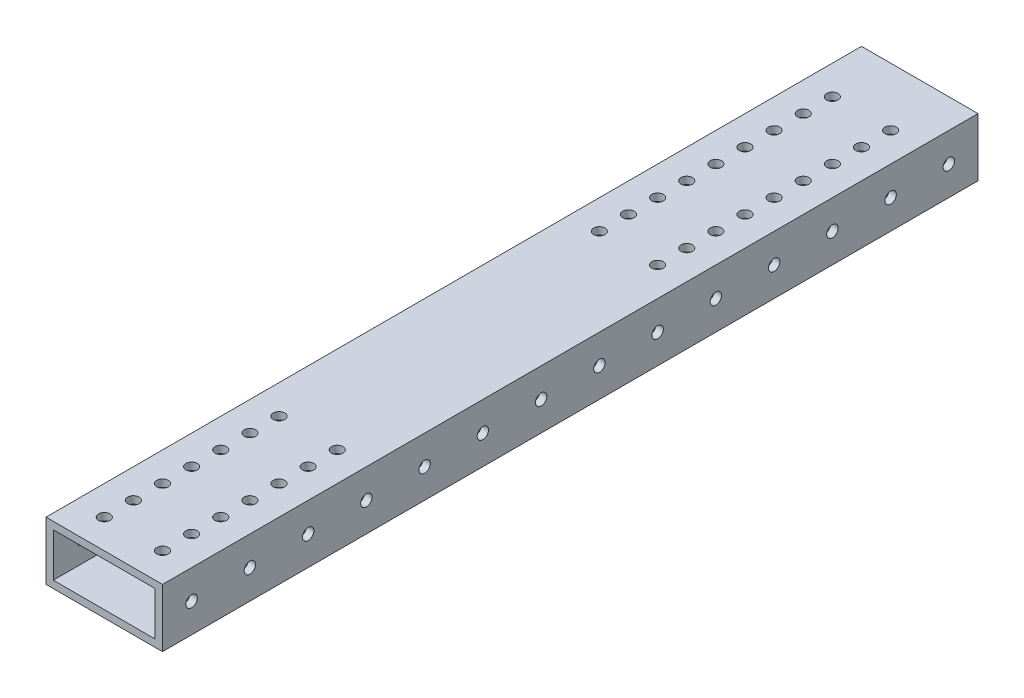
from build123d import *

# Parameters (mm, degrees)
SKETCH1_W           = 50.8
SKETCH1_H           = 25.4
SKETCH1_W_2         = 44.45
SKETCH1_H_2         = 19.05
BOSS_EXTRUDE1_DEPTH = 177.8
CUT_EXTRUDE1_REACH  = 183.392
SKETCH2_R           = 2.4892
SKETCH3_R           = 2.4892
CUT_EXTRUDE2_DEPTH  = 186.350397895
SKETCH4_R           = 2.4892
CUT_EXTRUDE3_DEPTH  = 182.392282085


with BuildPart() as part:
    # Sketch1 → Boss-Extrude1 (new, symmetric)
    with BuildSketch(Plane.XY):
        Rectangle(SKETCH1_W, SKETCH1_H)
        Rectangle(SKETCH1_W_2, SKETCH1_H_2, mode=Mode.SUBTRACT)
    extrude(amount=BOSS_EXTRUDE1_DEPTH, both=True)

    # Sketch2 → Cut-Extrude1 (cut, up to next)
    with BuildSketch(Plane.XZ.offset(-12.7), mode=Mode.PRIVATE) as cut_extrude1_sk1:
        with Locations((-12.7, 165.1)):
            Circle(SKETCH2_R)
    cut_extrude1_tool1 = extrude(cut_extrude1_sk1.sketch, amount=CUT_EXTRUDE1_REACH, mode=Mode.PRIVATE) & part.part
    # Sketch2 → Cut-Extrude1 (cut, up to next)
    with BuildSketch(Plane.XZ.offset(-12.7), mode=Mode.PRIVATE) as cut_extrude1_sk2:
        with Locations((-12.7, 152.4)):
            Circle(SKETCH2_R)
    cut_extrude1_tool2 = extrude(cut_extrude1_sk2.sketch, amount=CUT_EXTRUDE1_REACH, mode=Mode.PRIVATE) & part.part
    # Sketch2 → Cut-Extrude1 (cut, up to next)
    with BuildSketch(Plane.XZ.offset(-12.7), mode=Mode.PRIVATE) as cut_extrude1_sk3:
        with Locations((-12.7, 139.7)):
            Circle(SKETCH2_R)
    cut_extrude1_tool3 = extrude(cut_extrude1_sk3.sketch, amount=CUT_EXTRUDE1_REACH, mode=Mode.PRIVATE) & part.part
    # Sketch2 → Cut-Extrude1 (cut, up to next)
    with BuildSketch(Plane.XZ.offset(-12.7), mode=Mode.PRIVATE) as cut_extrude1_sk4:
        with Locations((-12.7, 127)):
            Circle(SKETCH2_R)
    cut_extrude1_tool4 = extrude(cut_extrude1_sk4.sketch, amount=CUT_EXTRUDE1_REACH, mode=Mode.PRIVATE) & part.part
    # Sketch2 → Cut-Extrude1 (cut, up to next)
    with BuildSketch(Plane.XZ.offset(-12.7), mode=Mode.PRIVATE) as cut_extrude1_sk5:
        with Locations((-12.7, 114.3)):
            Circle(SKETCH2_R)
    cut_extrude1_tool5 = extrude(cut_extrude1_sk5.sketch, amount=CUT_EXTRUDE1_REACH, mode=Mode.PRIVATE) & part.part
    # Sketch2 → Cut-Extrude1 (cut, up to next)
    with BuildSketch(Plane.XZ.offset(-12.7), mode=Mode.PRIVATE) as cut_extrude1_sk6:
        with Locations((-12.7, 101.6)):
            Circle(SKETCH2_R)
    cut_extrude1_tool6 = extrude(cut_extrude1_sk6.sketch, amount=CUT_EXTRUDE1_REACH, mode=Mode.PRIVATE) & part.part
    # Sketch2 → Cut-Extrude1 (cut, up to next)
    with BuildSketch(Plane.XZ.offset(-12.7), mode=Mode.PRIVATE) as cut_extrude1_sk7:
        with Locations((-12.7, 88.9)):
            Circle(SKETCH2_R)
    cut_extrude1_tool7 = extrude(cut_extrude1_sk7.sketch, amount=CUT_EXTRUDE1_REACH, mode=Mode.PRIVATE) & part.part
    # Sketch2 → Cut-Extrude1 (cut, up to next)
    with BuildSketch(Plane.XZ.offset(-12.7), mode=Mode.PRIVATE) as cut_extrude1_sk8:
        with Locations((12.7, 165.1)):
            Circle(SKETCH2_R)
    cut_extrude1_tool8 = extrude(cut_extrude1_sk8.sketch, amount=CUT_EXTRUDE1_REACH, mode=Mode.PRIVATE) & part.part
    # Sketch2 → Cut-Extrude1 (cut, up to next)
    with BuildSketch(Plane.XZ.offset(-12.7), mode=Mode.PRIVATE) as cut_extrude1_sk9:
        with Locations((12.7, 152.4)):
            Circle(SKETCH2_R)
    cut_extrude1_tool9 = extrude(cut_extrude1_sk9.sketch, amount=CUT_EXTRUDE1_REACH, mode=Mode.PRIVATE) & part.part
    # Sketch2 → Cut-Extrude1 (cut, up to next)
    with BuildSketch(Plane.XZ.offset(-12.7), mode=Mode.PRIVATE) as cut_extrude1_sk10:
        with Locations((12.7, 139.7)):
            Circle(SKETCH2_R)
    cut_extrude1_tool10 = extrude(cut_extrude1_sk10.sketch, amount=CUT_EXTRUDE1_REACH, mode=Mode.PRIVATE) & part.part
    # Sketch2 → Cut-Extrude1 (cut, up to next)
    with BuildSketch(Plane.XZ.offset(-12.7), mode=Mode.PRIVATE) as cut_extrude1_sk11:
        with Locations((12.7, 127)):
            Circle(SKETCH2_R)
    cut_extrude1_tool11 = extrude(cut_extrude1_sk11.sketch, amount=CUT_EXTRUDE1_REACH, mode=Mode.PRIVATE) & part.part
    # Sketch2 → Cut-Extrude1 (cut, up to next)
    with BuildSketch(Plane.XZ.offset(-12.7), mode=Mode.PRIVATE) as cut_extrude1_sk12:
        with Locations((12.7, 114.3)):
            Circle(SKETCH2_R)
    cut_extrude1_tool12 = extrude(cut_extrude1_sk12.sketch, amount=CUT_EXTRUDE1_REACH, mode=Mode.PRIVATE) & part.part
    # Sketch2 → Cut-Extrude1 (cut, up to next)
    with BuildSketch(Plane.XZ.offset(-12.7), mode=Mode.PRIVATE) as cut_extrude1_sk13:
        with Locations((12.7, 101.6)):
            Circle(SKETCH2_R)
    cut_extrude1_tool13 = extrude(cut_extrude1_sk13.sketch, amount=CUT_EXTRUDE1_REACH, mode=Mode.PRIVATE) & part.part
    # Sketch2 → Cut-Extrude1 (cut, up to next)
    with BuildSketch(Plane.XZ.offset(-12.7), mode=Mode.PRIVATE) as cut_extrude1_sk14:
        with Locations((12.7, 88.9)):
            Circle(SKETCH2_R)
    cut_extrude1_tool14 = extrude(cut_extrude1_sk14.sketch, amount=CUT_EXTRUDE1_REACH, mode=Mode.PRIVATE) & part.part
    add(cut_extrude1_tool1.solids().sort_by_distance((-12.7, 12.7, 165.1))[0], mode=Mode.SUBTRACT)
    add(cut_extrude1_tool2.solids().sort_by_distance((-12.7, 12.7, 152.4))[0], mode=Mode.SUBTRACT)
    add(cut_extrude1_tool3.solids().sort_by_distance((-12.7, 12.7, 139.7))[0], mode=Mode.SUBTRACT)
    add(cut_extrude1_tool4.solids().sort_by_distance((-12.7, 12.7, 127))[0], mode=Mode.SUBTRACT)
    add(cut_extrude1_tool5.solids().sort_by_distance((-12.7, 12.7, 114.3))[0], mode=Mode.SUBTRACT)
    add(cut_extrude1_tool6.solids().sort_by_distance((-12.7, 12.7, 101.6))[0], mode=Mode.SUBTRACT)
    add(cut_extrude1_tool7.solids().sort_by_distance((-12.7, 12.7, 88.9))[0], mode=Mode.SUBTRACT)
    add(cut_extrude1_tool8.solids().sort_by_distance((12.7, 12.7, 165.1))[0], mode=Mode.SUBTRACT)
    add(cut_extrude1_tool9.solids().sort_by_distance((12.7, 12.7, 152.4))[0], mode=Mode.SUBTRACT)
    add(cut_extrude1_tool10.solids().sort_by_distance((12.7, 12.7, 139.7))[0], mode=Mode.SUBTRACT)
    add(cut_extrude1_tool11.solids().sort_by_distance((12.7, 12.7, 127))[0], mode=Mode.SUBTRACT)
    add(cut_extrude1_tool12.solids().sort_by_distance((12.7, 12.7, 114.3))[0], mode=Mode.SUBTRACT)
    add(cut_extrude1_tool13.solids().sort_by_distance((12.7, 12.7, 101.6))[0], mode=Mode.SUBTRACT)
    add(cut_extrude1_tool14.solids().sort_by_distance((12.7, 12.7, 88.9))[0], mode=Mode.SUBTRACT)

    # Sketch3 → Cut-Extrude2 (cut, through all)
    with BuildSketch(Plane(origin=(25.4, 0, 0), x_dir=(0, 0, -1), z_dir=(1, 0, 0))):
        with Locations((-165.1, 0)):
            Circle(SKETCH3_R)
        with Locations((-139.7, 0)):
            Circle(SKETCH3_R)
        with Locations((-114.3, 0)):
            Circle(SKETCH3_R)
        with Locations((-88.9, 0)):
            Circle(SKETCH3_R)
        with Locations((-63.5, 0)):
            Circle(SKETCH3_R)
        with Locations((-38.1, 0)):
            Circle(SKETCH3_R)
        with Locations((-12.7, 0)):
            Circle(SKETCH3_R)
        with Locations((12.7, 0)):
            Circle(SKETCH3_R)
        with Locations((38.1, 0)):
            Circle(SKETCH3_R)
        with Locations((63.5, 0)):
            Circle(SKETCH3_R)
        with Locations((88.9, 0)):
            Circle(SKETCH3_R)
        with Locations((114.3, 0)):
            Circle(SKETCH3_R)
        with Locations((139.7, 0)):
            Circle(SKETCH3_R)
        with Locations((165.1, 0)):
            Circle(SKETCH3_R)
    extrude(amount=-CUT_EXTRUDE2_DEPTH, mode=Mode.SUBTRACT)

    # Sketch4 → Cut-Extrude3 (cut, through all)
    with BuildSketch(Plane.XZ.offset(12.7)):
        with Locations((-12.7, -152.4)):
            Circle(SKETCH4_R)
        with Locations((-12.7, -139.7)):
            Circle(SKETCH4_R)
        with Locations((-12.7, -127)):
            Circle(SKETCH4_R)
        with Locations((-12.7, -114.3)):
            Circle(SKETCH4_R)
        with Locations((-12.7, -101.6)):
            Circle(SKETCH4_R)
        with Locations((-12.7, -88.9)):
            Circle(SKETCH4_R)
        with Locations((-12.7, -76.2)):
            Circle(SKETCH4_R)
        with Locations((-12.7, -63.5)):
            Circle(SKETCH4_R)
        with Locations((-12.7, -50.8)):
            Circle(SKETCH4_R)
        with Locations((12.7, -50.8)):
            Circle(SKETCH4_R)
        with Locations((12.7, -63.5)):
            Circle(SKETCH4_R)
        with Locations((12.7, -76.2)):
            Circle(SKETCH4_R)
        with Locations((12.7, -88.9)):
            Circle(SKETCH4_R)
        with Locations((12.7, -101.6)):
            Circle(SKETCH4_R)
        with Locations((12.7, -114.3)):
            Circle(SKETCH4_R)
        with Locations((12.7, -127)):
            Circle(SKETCH4_R)
        with Locations((12.7, -139.7)):
            Circle(SKETCH4_R)
        with Locations((12.7, -152.4)):
            Circle(SKETCH4_R)
    extrude(amount=-CUT_EXTRUDE3_DEPTH, mode=Mode.SUBTRACT)


solid = part.part
